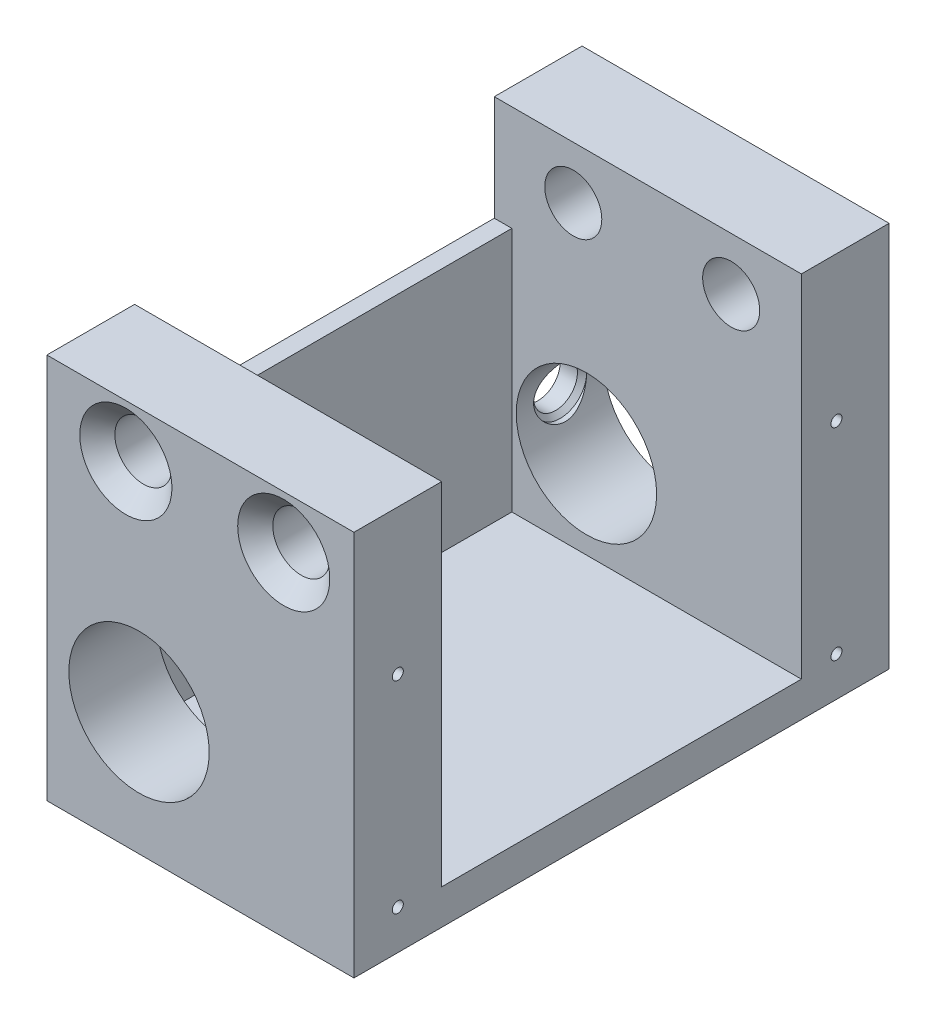
from build123d import *

# Parameters (mm, degrees)
SKETCH_1_W                       = 35
SKETCH_1_H                       = 44
EXTRUDE_1_DEPTH                  = 30.5
SKETCH_3_W                       = 41
SKETCH_3_H                       = 40
CUT_EXTRUDE_1_DEPTH              = 33
SKETCH_4_W                       = 41
SKETCH_4_H                       = 12
CUT_EXTRUDE_2_DEPTH              = 33
SKETCH_5_R                       = 8
CUT_EXTRUDE_3_DEPTH              = 83.957820608
HOLE_WIZARD_6_5_6_5_1_AT_2_COUNT = 2
HOLE_WIZARD_6_5_6_5_1_AT_2_PITCH = 18


# Read off the part's stored shape, not the designer's step: M1.6 螺纹孔1, M6 螺纹孔1
with BuildPart() as part:
    # 草图1 → 凸台-拉伸1 (new, symmetric)
    with BuildSketch(Plane.XY):
        with Locations((17.5, 22)):
            Rectangle(SKETCH_1_W, SKETCH_1_H)
    extrude(amount=EXTRUDE_1_DEPTH, both=True)

    # 草图3 → 切除-拉伸1 (cut)
    with BuildSketch(Plane(origin=(35, 0, 0), x_dir=(0, 0, -1), z_dir=(1, 0, 0))):
        with Locations((0, 24)):
            Rectangle(SKETCH_3_W, SKETCH_3_H)
    extrude(amount=-CUT_EXTRUDE_1_DEPTH, mode=Mode.SUBTRACT)

    # 草图4 → 切除-拉伸2 (cut)
    with BuildSketch(Plane(origin=(2, 0, 0), x_dir=(0, 0, -1), z_dir=(1, 0, 0))):
        with Locations((0, 38)):
            Rectangle(SKETCH_4_W, SKETCH_4_H)
    extrude(amount=-CUT_EXTRUDE_2_DEPTH, mode=Mode.SUBTRACT)

    # 草图5 → 切除-拉伸3 (cut, through all)
    with BuildSketch(Plane.XY.offset(30.5)):
        with Locations((10.5, 14)):
            Circle(SKETCH_5_R)
    extrude(amount=-CUT_EXTRUDE_3_DEPTH, mode=Mode.SUBTRACT)

    # 草图7 → Ø6.5 (6.5) 直径孔1 (revolve, cut)
    with BuildSketch(Plane(origin=(9, 38, -20.5), x_dir=(0, -1, 0), z_dir=(1, 0, 0))):
        Polygon((0, 0), (0, 10), (5.25, 10), (3.25, 8), (3.25, 0), align=None)
    hole_wizard_6_5_6_5_1 = revolve(axis=Axis((9, 38, -14.15), (0, 0, -1)), mode=Mode.SUBTRACT)

    # Ø6.5 (6.5) 直径孔1 at 2: Ø6.5 (6.5) 直径孔1 ×2
    with Locations(*[(i * HOLE_WIZARD_6_5_6_5_1_AT_2_PITCH, 0, 0) for i in range(1, HOLE_WIZARD_6_5_6_5_1_AT_2_COUNT)]):
        add(hole_wizard_6_5_6_5_1, mode=Mode.SUBTRACT)

    # 镜向1: Ø6.5 (6.5) 直径孔1 across plane
    add(hole_wizard_6_5_6_5_1.mirror(Plane.XY), mode=Mode.SUBTRACT)

    # 镜向1 copy 1 sketch → 镜向1 copy 1 (revolve, cut)
    with BuildSketch(Plane(origin=(27, 38, 20.5), x_dir=(0, -1, 0), z_dir=(1, 0, 0))):
        Polygon((0, 0), (0, -10), (5.25, -10), (3.25, -8), (3.25, 0), align=None)
    revolve(axis=Axis((27, 38, 14.15), (0, 0, -1)), mode=Mode.SUBTRACT)

    # M1.6 螺纹孔1 outline → M1.6 螺纹孔1 (revolve, cut)
    with BuildSketch(Plane(origin=(0, 27.5, 25.5), x_dir=(0, 1, 0), z_dir=(0, 0, -1))):
        Polygon((0, 35), (0, 26.624462113), (0.625, 27), (0.625, 35), align=None)
    revolve(axis=Axis((0, 27.5, 25.5), (1, 0, 0)), mode=Mode.SUBTRACT)

    # Hole Wizard M1.6 _1 2 outline → Hole Wizard M1.6 _1 2 (revolve, cut)
    with BuildSketch(Plane(origin=(0, 4.5, -24.5), x_dir=(0, 1, 0), z_dir=(0, 0, -1))):
        Polygon((0, 35), (0, 26.624462113), (0.625, 27), (0.625, 35), align=None)
    revolve(axis=Axis((0, 4.5, -24.5), (1, 0, 0)), mode=Mode.SUBTRACT)

    # Hole Wizard M1.6 _1 3 outline → Hole Wizard M1.6 _1 3 (revolve, cut)
    with BuildSketch(Plane(origin=(0, 27.5, -24.5), x_dir=(0, 1, 0), z_dir=(0, 0, -1))):
        Polygon((0, 35), (0, 26.624462113), (0.625, 27), (0.625, 35), align=None)
    revolve(axis=Axis((0, 27.5, -24.5), (1, 0, 0)), mode=Mode.SUBTRACT)

    # Hole Wizard M1.6 _1 4 outline → Hole Wizard M1.6 _1 4 (revolve, cut)
    with BuildSketch(Plane(origin=(0, 4.5, 25.5), x_dir=(0, 1, 0), z_dir=(0, 0, -1))):
        Polygon((0, 35), (0, 26.624462113), (0.625, 27), (0.625, 35), align=None)
    revolve(axis=Axis((0, 4.5, 25.5), (1, 0, 0)), mode=Mode.SUBTRACT)

    # M6 螺纹孔1 outline → M6 螺纹孔1 (revolve, cut)
    with BuildSketch(Plane(origin=(0, 14, -25.5), x_dir=(0, 1, 0), z_dir=(0, 0, -1))):
        Polygon((3.025, 2.499998942), (3.025, 3.094213479), (2.5, 3.094219892), (2.5, 1.975), align=None)
        Polygon((2.5, 1.975), (2.5, 3.094219892), (0, 3.094219892), (0, 0), (2.5, 0), align=None)
    revolve(axis=Axis((0, 14, -25.5), (1, 0, 0)), mode=Mode.SUBTRACT)


solid = part.part
